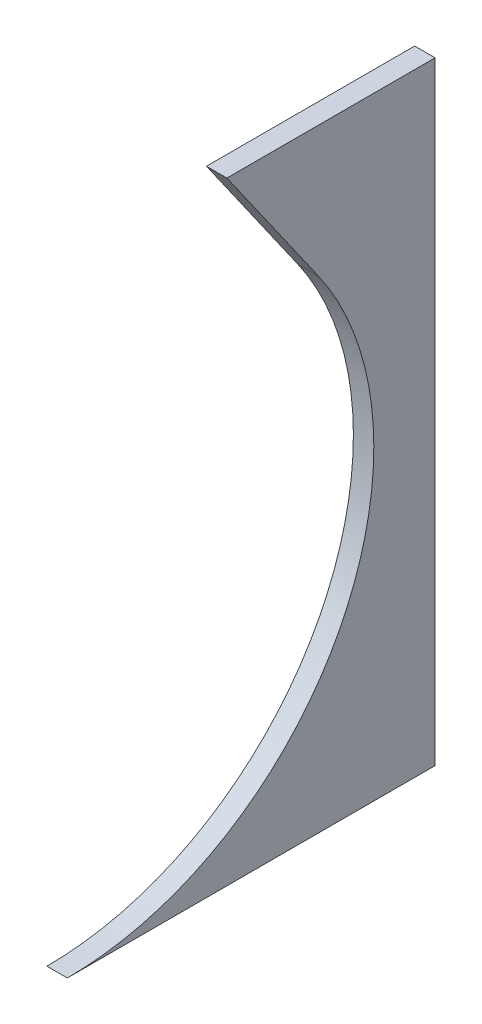
from build123d import *

# Parameters (mm, degrees)
SKETCH1_W           = 228.6
SKETCH1_H           = 381
BOSS_EXTRUDE1_DEPTH = 12.7
SKETCH2_R           = 190.5
CUT_EXTRUDE1_DEPTH  = 260.49677262
CUT_EXTRUDE2_DEPTH  = 260.49677262


with BuildPart() as part:
    # Sketch1 → Boss-Extrude1 (new body)
    with BuildSketch(Plane(origin=(0, 0, 0), x_dir=(0, 0, -1), z_dir=(1, 0, 0))):
        with Locations((19.05, 31.75)):
            Rectangle(SKETCH1_W, SKETCH1_H)
    extrude(amount=BOSS_EXTRUDE1_DEPTH)

    # Sketch2 → Cut-Extrude1 (cut, through all)
    with BuildSketch(Plane(origin=(12.7, 0, 0), x_dir=(0, 0, -1), z_dir=(1, 0, 0))):
        with Locations((-95.25, 31.75)):
            Circle(SKETCH2_R)
    extrude(amount=-CUT_EXTRUDE1_DEPTH, mode=Mode.SUBTRACT)

    # Sketch3 → Cut-Extrude2 (cut, through all)
    with BuildSketch(Plane(origin=(12.7, 0, 0), x_dir=(0, 0, -1), z_dir=(1, 0, 0))):
        Polygon((60.798464437, 141.016311125), (-14.580708336, 248.66892647), (-203.446235094, 248.66892647), (-203.446235094, 141.016311125), align=None)
    extrude(amount=-CUT_EXTRUDE2_DEPTH, mode=Mode.SUBTRACT)


solid = part.part
